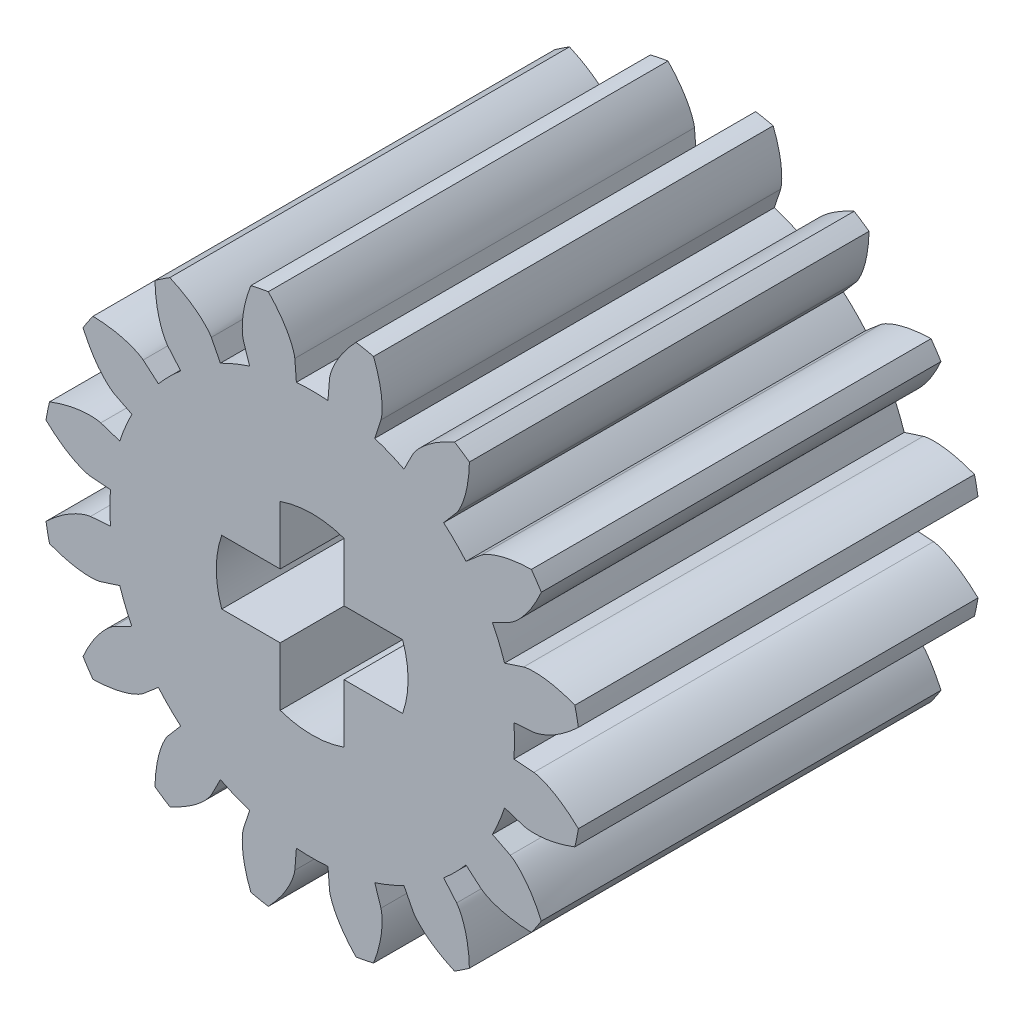
from build123d import *

# Parameters (mm, degrees)
SKETCH1_R           = 6.75
BOSS_EXTRUDE1_DEPTH = 10
CUT_EXTRUDE3_DEPTH  = 14.824796563
CIRPATTERN1_COUNT   = 16
CUT_EXTRUDE4_DEPTH  = 14.737484445


with BuildPart() as part:
    # Sketch1 → Boss-Extrude1 (new body)
    with BuildSketch(Plane.XY):
        Circle(SKETCH1_R)
    extrude(amount=BOSS_EXTRUDE1_DEPTH)

    # Sketch3 → Cut-Extrude3 (cut, through all)
    with BuildSketch(Plane.XY):
        with BuildLine():
            add(Edge.make_bspline(
                [(0.434163713, 5.546135436), (0.436630111, 5.568887632), (0.447025975, 5.619389016), (0.472378991, 5.707357547), (0.514598388, 5.8199145), (0.556796354, 5.910501464), (0.584227269, 5.963693803), (0.588102842, 5.97110836)],
                knots=[0, 0, 0, 0, 0.040008387, 0.090017613, 0.160030412, 0.250046806, 0.264674884, 0.264674884, 0.264674884, 0.264674884], degree=3))
            add(Edge.make_bspline(
                [(0.588102842, 5.97110836), (0.647776123, 6.085272362), (0.763412421, 6.267141587), (0.941222365, 6.491761304), (1.047182351, 6.60848955), (1.096933403, 6.660273051)],
                knots=[0.264674884, 0.264674884, 0.264674884, 0.264674884, 0.489907489, 0.63993471, 0.765498984, 0.765498984, 0.765498984, 0.765498984], degree=3))
            ThreePointArc((1.096933403, 6.660273051), (0, 6.75), (-1.096933403, 6.660273051))
            add(Edge.make_bspline(
                [(-0.588102842, 5.97110836), (-0.647776123, 6.085272362), (-0.763412421, 6.267141587), (-0.941222365, 6.491761304), (-1.047182351, 6.60848955), (-1.096933403, 6.660273051)],
                knots=[0.264674884, 0.264674884, 0.264674884, 0.264674884, 0.489907489, 0.63993471, 0.765498984, 0.765498984, 0.765498984, 0.765498984], degree=3))
            add(Edge.make_bspline(
                [(-0.434163713, 5.546135436), (-0.436630111, 5.568887632), (-0.447025975, 5.619389016), (-0.472378991, 5.707357547), (-0.514598388, 5.8199145), (-0.556796354, 5.910501464), (-0.584227269, 5.963693803), (-0.588102842, 5.97110836)],
                knots=[0, 0, 0, 0, 0.040008387, 0.090017613, 0.160030412, 0.250046806, 0.264674884, 0.264674884, 0.264674884, 0.264674884], degree=3))
            Line((-0.434163713, 5.546135436), (-0.395094922, 5.047059169))
            ThreePointArc((-0.395094922, 5.047059169), (0, 5.0625), (0.395094922, 5.047059169))
            Line((0.395094922, 5.047059169), (0.434163713, 5.546135436))
        make_face()
    cut_extrude3 = extrude(amount=CUT_EXTRUDE3_DEPTH, mode=Mode.SUBTRACT)

    # CirPattern1: Cut-Extrude3 ×16 about axis
    cirpattern1_axis = Axis((0, 0, 71.213492813), (0, 0, -1))
    for i in range(1, CIRPATTERN1_COUNT):
        add(cut_extrude3.rotate(cirpattern1_axis, i * 360 / CIRPATTERN1_COUNT), mode=Mode.SUBTRACT)

    # Sketch5 → Cut-Extrude4 (cut, through all)
    with BuildSketch(Plane.XY):
        with BuildLine():
            Line((-2.2627417, 0.8), (-0.8, 0.8))
            Line((-0.8, 0.8), (-0.8, 2.2627417))
            ThreePointArc((-0.8, 2.2627417), (0, 2.4), (0.8, 2.2627417))
            Line((0.8, 2.2627417), (0.8, 0.8))
            Line((0.8, 0.8), (2.2627417, 0.8))
            ThreePointArc((2.2627417, 0.8), (2.4, 0), (2.2627417, -0.8))
            Line((2.2627417, -0.8), (0.8, -0.8))
            Line((0.8, -0.8), (0.8, -2.2627417))
            ThreePointArc((0.8, -2.2627417), (0, -2.4), (-0.8, -2.2627417))
            Line((-0.8, -2.2627417), (-0.8, -0.8))
            Line((-0.8, -0.8), (-2.2627417, -0.8))
            ThreePointArc((-2.2627417, -0.8), (-2.4, 0), (-2.2627417, 0.8))
        make_face()
    extrude(amount=CUT_EXTRUDE4_DEPTH, mode=Mode.SUBTRACT)


solid = part.part
